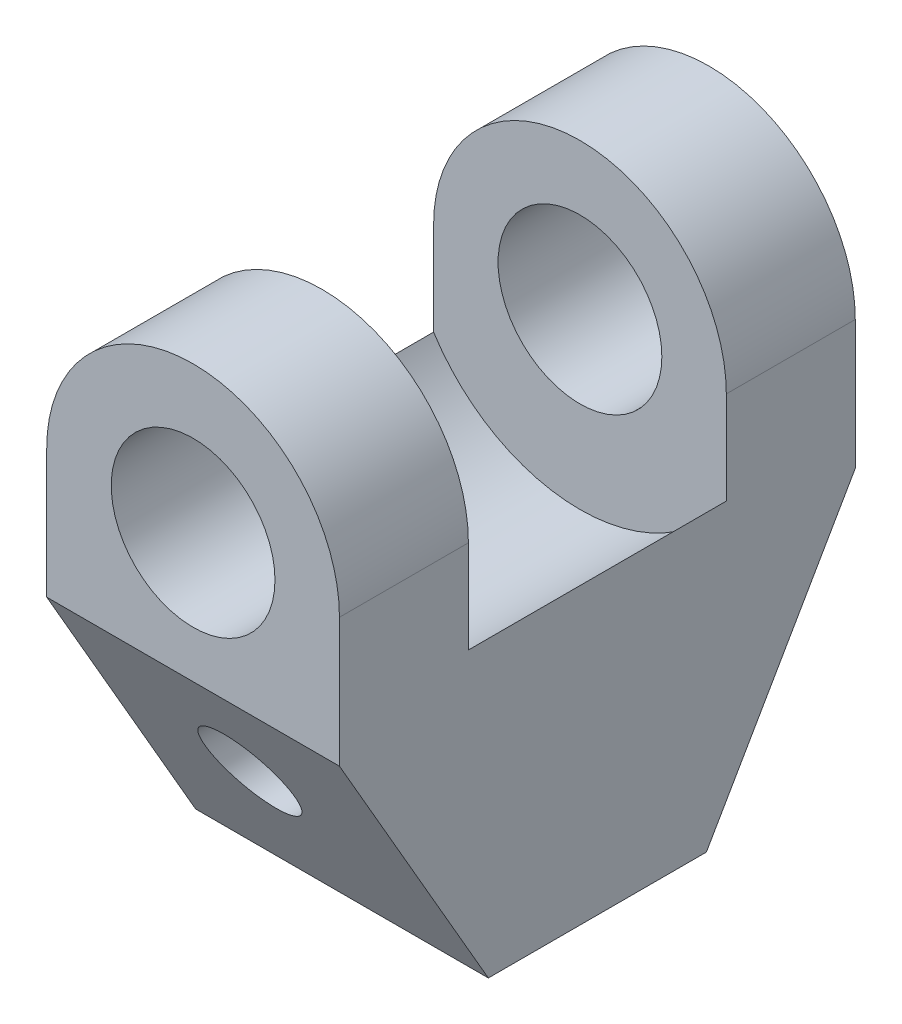
from build123d import *

# Parameters (mm, degrees)
SKETCH2_R           = 6.35
SKETCH2_R_2         = 3.5
BOSS_EXTRUDE1_DEPTH = 10
BOSS_EXTRUDE2_DEPTH = 10
SKETCH2_4_W         = 10
SKETCH2_4_H         = 15
SKETCH2_4_R         = 1.5
BOSS_EXTRUDE3_DEPTH = 7.75
CHAMFER1_SIZE       = 20
CHAMFER1_SIZE_2     = 11.547005384


with BuildPart() as part:
    # Sketch2 → Boss-Extrude1 (new body)
    with BuildSketch(Plane.XY):
        with BuildLine():
            ThreePointArc((11.35, 0), (0, 11.35), (-11.35, 0))
            Line((-11.35, 0), (-11.35, -30))
            Line((-11.35, -30), (11.35, -30))
            Line((11.35, -30), (11.35, 0))
        make_face()
        Circle(SKETCH2_R, mode=Mode.SUBTRACT)
        with Locations((-0.790227169, -19)):
            Circle(SKETCH2_R_2, mode=Mode.SUBTRACT)
    extrude(amount=BOSS_EXTRUDE1_DEPTH)

    # Sketch2<3> → Boss-Extrude2 (add)
    with BuildSketch(Plane.XY):
        with BuildLine():
            ThreePointArc((11.35, -7.197992776), (0, -13.44), (-11.35, -7.197992776))
            Line((-11.35, -7.197992776), (-11.35, -30))
            Line((-11.35, -30), (-5.790227169, -30))
            Line((-5.790227169, -30), (-5.790227169, -15))
            Line((-5.790227169, -15), (4.209772831, -15))
            Line((4.209772831, -15), (4.209772831, -30))
            Line((4.209772831, -30), (11.35, -30))
            Line((11.35, -30), (11.35, -7.197992776))
        make_face()
    extrude(amount=-BOSS_EXTRUDE2_DEPTH)

    # Sketch2<4> → Boss-Extrude3 (add)
    with BuildSketch(Plane.XY):
        with Locations((-0.790227169, -22.5)):
            Rectangle(SKETCH2_4_W, SKETCH2_4_H)
        with Locations((-0.790227169, -19)):
            Circle(SKETCH2_4_R, mode=Mode.SUBTRACT)
    extrude(amount=-BOSS_EXTRUDE3_DEPTH)

    # Chamfer1
    # the kernel refuses this chamfer: 20, 11.547005384 mm, written as the material it takes off along each edge
    with BuildSketch(Plane(origin=(-63.091715093, -30, 10), x_dir=(0, 0.9998132206222079, 0.019326765612700723), z_dir=(1, 0, 0))) as chamfer1_piece_1:
        Polygon((CHAMFER1_SIZE * 0.999813220622, -CHAMFER1_SIZE * 0.0193267656127), (-CHAMFER1_SIZE_2 * 0.0193267656124, -CHAMFER1_SIZE_2 * 0.999813220604), (0, 0), align=None)
    extrude(amount=126.183430186, mode=Mode.SUBTRACT)

    # Mirror1: part across plane


with BuildPart() as part_1:
    add(part.part)
    add(part.part.mirror(Plane.XY.offset(-10)))


solid = part_1.part
